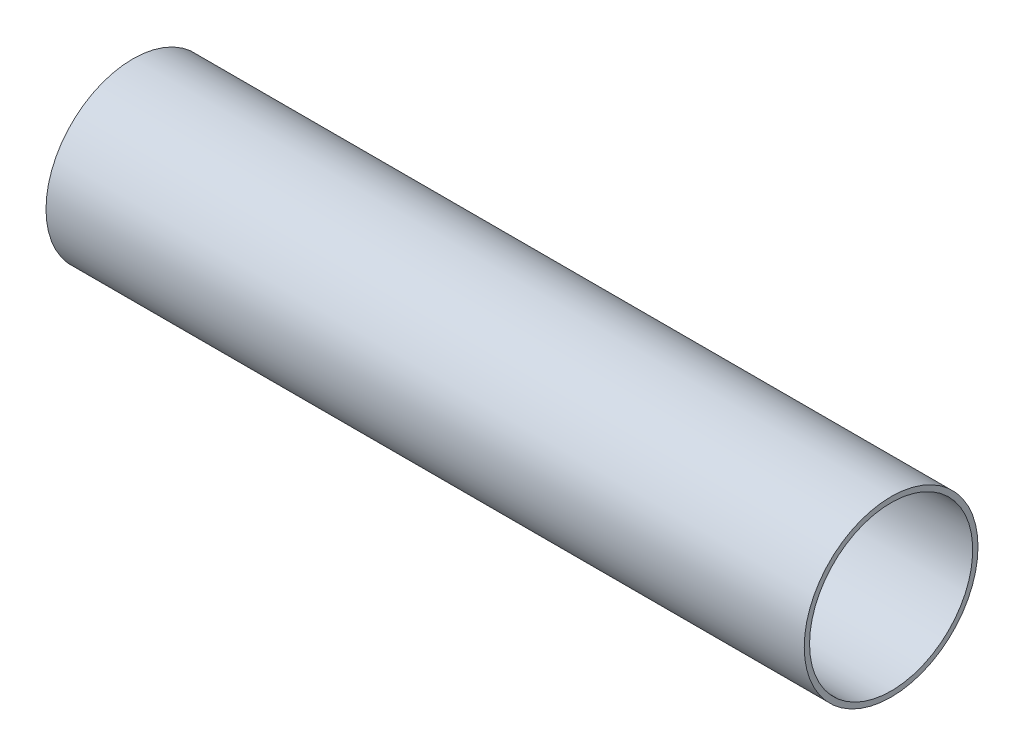
from build123d import *

# Parameters (mm, degrees)
SKETCH1_R      = 17.4625
SKETCH1_R_2    = 16.3957
EXTRUDE1_DEPTH = 76.2


with BuildPart() as part:
    # Sketch1 → Extrude1 (new, symmetric)
    with BuildSketch(Plane(origin=(0, 0, 0), x_dir=(0, 0, -1), z_dir=(1, 0, 0))):
        Circle(SKETCH1_R)
        Circle(SKETCH1_R_2, mode=Mode.SUBTRACT)
    extrude(amount=EXTRUDE1_DEPTH, both=True)


solid = part.part
